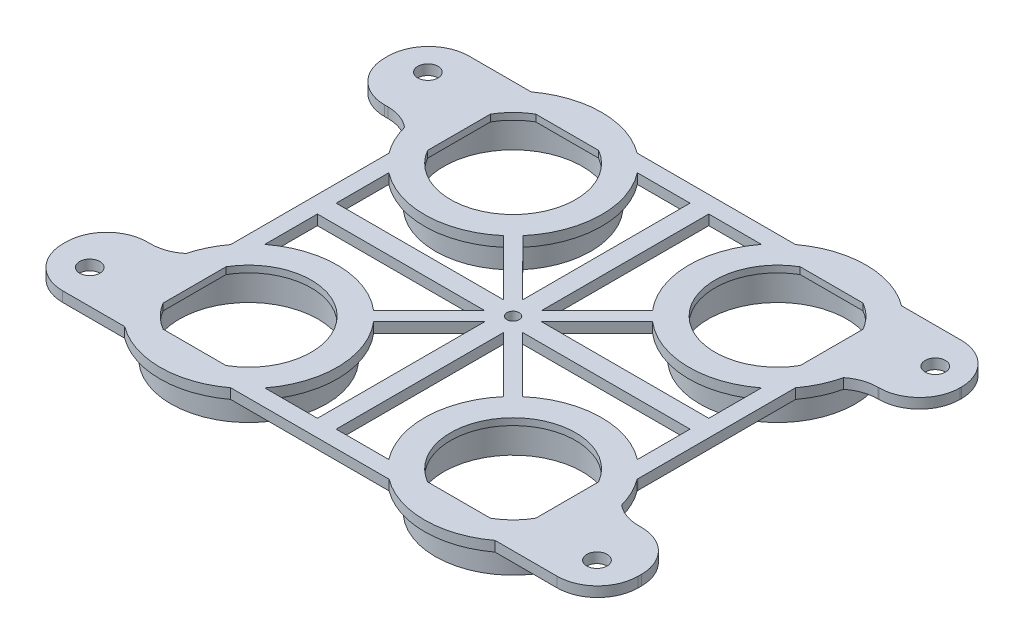
from build123d import *

# Parameters (mm, degrees)
SKETCH1_W           = 120.2
SKETCH1_H           = 120.2
SKETCH1_W_2         = 110.2
SKETCH1_H_2         = 110.2
BOSS_EXTRUDE1_DEPTH = 3
SKETCH3_W           = 25
SKETCH3_H           = 25
SKETCH3_R           = 3
SKETCH3_W_2         = 24.35
SKETCH3_H_2         = 24.35
BOSS_EXTRUDE3_DEPTH = 3
FILLET1_R           = 12
SKETCH4_R           = 26.20371479
SKETCH4_R_2         = 18.5
BOSS_EXTRUDE4_DEPTH = 3
SKETCH5_R           = 23
SKETCH5_R_2         = 20.5
BOSS_EXTRUDE5_DEPTH = 8
SKETCH6_R           = 14.298791064
BOSS_EXTRUDE6_DEPTH = 5.7
CIRPATTERN1_COUNT   = 4
SKETCH7_R           = 21.686675293
CUT_EXTRUDE1_DEPTH  = 5.7
BOSS_EXTRUDE7_DEPTH = 3
BOSS_EXTRUDE8_DEPTH = 3
BOSS_EXTRUDE9_DEPTH = 3
CUT_EXTRUDE2_START  = -9
SKETCH12_R          = 20.5
CUT_EXTRUDE2_DEPTH  = 9
SKETCH14_R          = 1.812502671
CUT_EXTRUDE3_DEPTH  = 9
CIRPATTERN2_COUNT   = 4


with BuildPart() as part:
    # Sketch1 → Boss-Extrude1 (new body)
    with BuildSketch(Plane(origin=(0, 0, 0), x_dir=(1, 0, 0), z_dir=(0, 1, 0))):
        Rectangle(SKETCH1_W, SKETCH1_H)
        Rectangle(SKETCH1_W_2, SKETCH1_H_2, mode=Mode.SUBTRACT)
    extrude(amount=BOSS_EXTRUDE1_DEPTH)

    # Sketch3 → Boss-Extrude3 (add)
    # profile 1 of 4: a face of its own
    with BuildSketch(Plane(origin=(0, 0, 0), x_dir=(-1, 0, 0), z_dir=(0, -1, 0))):
        with Locations((72.6, -47.6)):
            Rectangle(SKETCH3_W, SKETCH3_H)
        with Locations((75.1, -50.1)):
            Circle(SKETCH3_R, mode=Mode.SUBTRACT)
    # profile 2 of 4: a face of its own
    with BuildSketch(Plane(origin=(0, 0, 0), x_dir=(-1, 0, 0), z_dir=(0, -1, 0))):
        with Locations((-72.275, 47.925)):
            Rectangle(SKETCH3_W_2, SKETCH3_H_2)
        with Locations((-75.260238187, 49.598128293)):
            Circle(SKETCH3_R, mode=Mode.SUBTRACT)
    # profile 3 of 4: a face of its own
    with BuildSketch(Plane(origin=(0, 0, 0), x_dir=(-1, 0, 0), z_dir=(0, -1, 0))):
        Polygon((-60.1, -60.1), (-60.1, -50.1), (-60.1, -35.1), (-85.1, -35.1), (-85.1, -60.1), align=None)
        with Locations((-74.9, -50.1)):
            Circle(SKETCH3_R, mode=Mode.SUBTRACT)
    # profile 4 of 4: a face of its own
    with BuildSketch(Plane(origin=(0, 0, 0), x_dir=(-1, 0, 0), z_dir=(0, -1, 0))):
        Polygon((60.1, 35.1), (75.1, 35.1), (85.1, 35.1), (85.1, 60.1), (60.1, 60.1), align=None)
        with Locations((75.1, 49.9)):
            Circle(SKETCH3_R, mode=Mode.SUBTRACT)
    extrude(amount=-BOSS_EXTRUDE3_DEPTH)

    # Fillet1
    fillet1_edges = [part.edges().sort_by_distance(p)[0] for p in [
        (85.1, 1.5, 60.1),
        (85.1, 1.5, 35.1),
        (60.1, 1.5, 35.1),
        (-85.1, 1.5, -60.1),
        (-85.1, 1.5, -35.1),
        (-60.1, 1.5, -35.1),
        (-60.1, 1.5, 35.1),
        (-85.1, 1.5, 60.1),
        (-85.1, 1.5, 35.1),
        (84.45, 1.5, -60.1),
        (84.45, 1.5, -35.75),
        (60.1, 1.5, -35.75),
    ]]
    fillet(fillet1_edges, radius=FILLET1_R)

    # Sketch4 → Boss-Extrude4 (add)
    with BuildSketch(Plane(origin=(0, 0, 0), x_dir=(-1, 0, 0), z_dir=(0, -1, 0))):
        with Locations((39.1, -39.1)):
            Circle(SKETCH4_R)
        with Locations((39.1, -39.1)):
            Circle(SKETCH4_R_2, mode=Mode.SUBTRACT)
    boss_extrude4 = extrude(amount=-BOSS_EXTRUDE4_DEPTH)

    # Sketch5 → Boss-Extrude5 (add)
    with BuildSketch(Plane(origin=(0, 0, 0), x_dir=(-1, 0, 0), z_dir=(0, -1, 0))):
        with Locations((39.1, -39.1)):
            Circle(SKETCH5_R)
        with Locations((39.1, -39.1)):
            Circle(SKETCH5_R_2, mode=Mode.SUBTRACT)
    boss_extrude5 = extrude(amount=BOSS_EXTRUDE5_DEPTH)

    # CirPattern1: Boss-Extrude4, Boss-Extrude5 ×4 about axis
    cirpattern1_axis = Axis((0, 0, 0), (0, 1, 0))
    add([boss_extrude4.rotate(cirpattern1_axis, i * 360 / CIRPATTERN1_COUNT) for i in range(1, CIRPATTERN1_COUNT)])
    add([boss_extrude5.rotate(cirpattern1_axis, i * 360 / CIRPATTERN1_COUNT) for i in range(1, CIRPATTERN1_COUNT)])

    # Sketch8 → Boss-Extrude7 (add)
    with BuildSketch(Plane(origin=(0, 0, 0), x_dir=(-1, 0, 0), z_dir=(0, -1, 0))):
        Polygon((2.773939536, -2.773939536), (55.1, -2.773939536), (55.1, 2.773939536), (2.773939536, 2.773939536), (2.773939536, 58.599472693), (-2.773939536, 58.599472693), (-2.773939536, 2.773939536), (-55.1, 2.773939536), (-55.1, -2.773939536), (-2.773939536, -2.773939536), (-2.773939536, -58.599472693), (2.773939536, -58.599472693), align=None)
    extrude(amount=-BOSS_EXTRUDE7_DEPTH)

    # Sketch9 → Boss-Extrude8 (add)
    with BuildSketch(Plane(origin=(0, 0, 0), x_dir=(-1, 0, 0), z_dir=(0, -1, 0))):
        Polygon((22.82424649, 20.034817185), (-19.99324685, -22.860669453), (-22.82424649, -20.034817185), (19.99324685, 22.860669453), align=None)
    extrude(amount=-BOSS_EXTRUDE8_DEPTH)

    # Sketch10 → Boss-Extrude9 (add)
    with BuildSketch(Plane(origin=(0, 0, 0), x_dir=(-1, 0, 0), z_dir=(0, -1, 0))):
        Polygon((23.384125812, -20.554528832), (-20.555773995, 23.383031261), (-23.384125812, 20.554528832), (20.555773995, -23.383031261), align=None)
    extrude(amount=-BOSS_EXTRUDE9_DEPTH)

    # Sketch12 → Cut-Extrude2 (cut)
    with BuildSketch(Plane(origin=(0, -8, 0), x_dir=(-1, 0, 0), z_dir=(0, -1, 0)).offset(CUT_EXTRUDE2_START)):
        with Locations((39.1, -39.1)):
            Circle(SKETCH12_R)
    cut_extrude2 = extrude(amount=CUT_EXTRUDE2_DEPTH, mode=Mode.SUBTRACT)

    # Sketch14 → Cut-Extrude3 (cut)
    with BuildSketch(Plane(origin=(0, 0, 0), x_dir=(-1, 0, 0), z_dir=(0, -1, 0))):
        Circle(SKETCH14_R)
    extrude(amount=-CUT_EXTRUDE3_DEPTH, mode=Mode.SUBTRACT)

    # CirPattern2: Cut-Extrude2 ×4 about axis
    cirpattern2_axis = Axis((0, 0, 0), (0, -1, 0))
    for i in range(1, CIRPATTERN2_COUNT):
        add(cut_extrude2.rotate(cirpattern2_axis, i * 360 / CIRPATTERN2_COUNT), mode=Mode.SUBTRACT)


with BuildPart() as body_2:
    # Sketch6 → Boss-Extrude6 (new body)
    with BuildSketch(Plane(origin=(0, 0, 0), x_dir=(1, 0, 0), z_dir=(0, 1, 0))):
        Circle(SKETCH6_R)
    extrude(amount=BOSS_EXTRUDE6_DEPTH)

    # Sketch7 → Cut-Extrude1 (cut)
    with BuildSketch(Plane(origin=(0, 0, 0), x_dir=(-1, 0, 0), z_dir=(0, -1, 0))):
        Circle(SKETCH7_R)
    extrude(amount=-CUT_EXTRUDE1_DEPTH, mode=Mode.SUBTRACT)


solid = part.part
